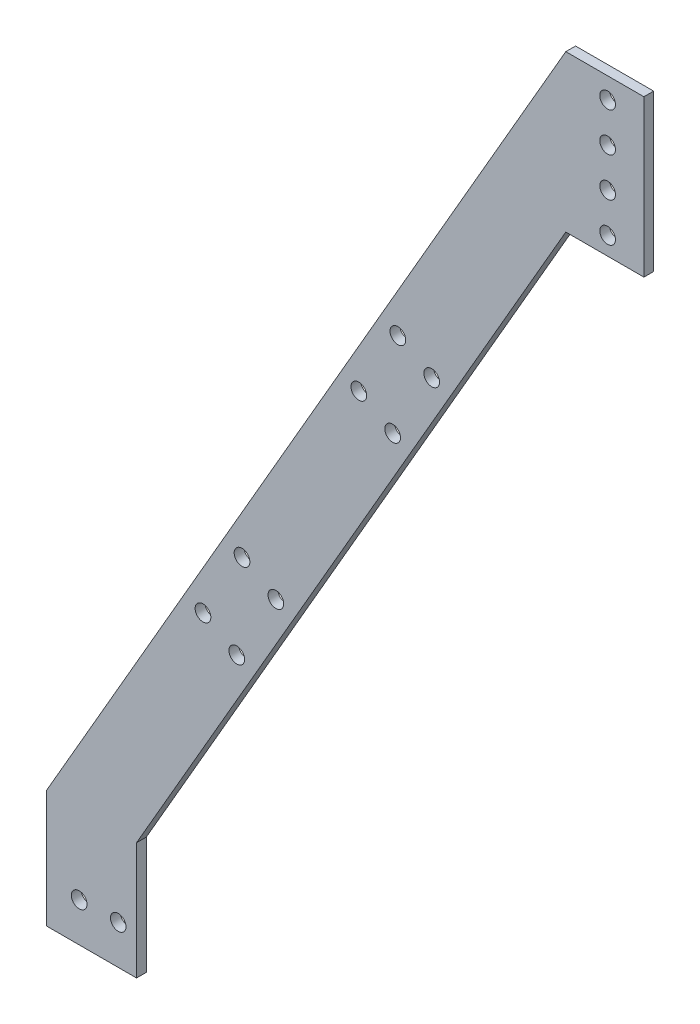
from build123d import *

# Parameters (mm, degrees)
BOSS_EXTRUDE1_DEPTH = 3.175
SKETCH2_R           = 2.5527
SKETCH2_R_2         = 2.522358926
CUT_EXTRUDE1_DEPTH  = 384.540032474
SKETCH3_R           = 2.5527
CUT_EXTRUDE2_DEPTH  = 384.540032474


with BuildPart() as part:
    # Sketch1 → Boss-Extrude1 (new body)
    with BuildSketch(Plane.XY):
        Polygon((0, 0), (0, 38.1), (168.91, 330.660701906), (194.31, 330.660701906), (194.31, 279.860701906), (168.91, 279.860701906), (29.329393675, 38.1), (29.329393675, 0), align=None)
    extrude(amount=BOSS_EXTRUDE1_DEPTH)

    # Sketch2 → Cut-Extrude1 (cut, through all)
    with BuildSketch(Plane.XY.offset(3.175)):
        with Locations((182.511063476, 323.850000008)):
            Circle(SKETCH2_R)
        with Locations((182.511063476, 311.150000008)):
            Circle(SKETCH2_R)
        with Locations((23.380063476, 12.7)):
            Circle(SKETCH2_R_2)
        with Locations((10.680063476, 12.7)):
            Circle(SKETCH2_R)
        with Locations((182.511063476, 285.750000008)):
            Circle(SKETCH2_R)
        with Locations((182.511063476, 298.450000008)):
            Circle(SKETCH2_R)
    extrude(amount=-CUT_EXTRUDE1_DEPTH, mode=Mode.SUBTRACT)

    # Sketch3 → Cut-Extrude2 (cut, through all)
    with BuildSketch(Plane.XY.offset(3.175)):
        with Locations((101.612216058, 201.397520882)):
            Circle(SKETCH3_R)
        with Locations((125.310738686, 217.044566138)):
            Circle(SKETCH3_R)
        with Locations((114.312216058, 223.394566138)):
            Circle(SKETCH3_R)
        with Locations((112.610738686, 195.047520882)):
            Circle(SKETCH3_R)
        with Locations((50.931609733, 113.616135768)):
            Circle(SKETCH3_R)
        with Locations((63.631609733, 135.613181024)):
            Circle(SKETCH3_R)
        with Locations((74.630132361, 129.263181024)):
            Circle(SKETCH3_R)
        with Locations((61.930132361, 107.266135768)):
            Circle(SKETCH3_R)
    extrude(amount=-CUT_EXTRUDE2_DEPTH, mode=Mode.SUBTRACT)


solid = part.part
